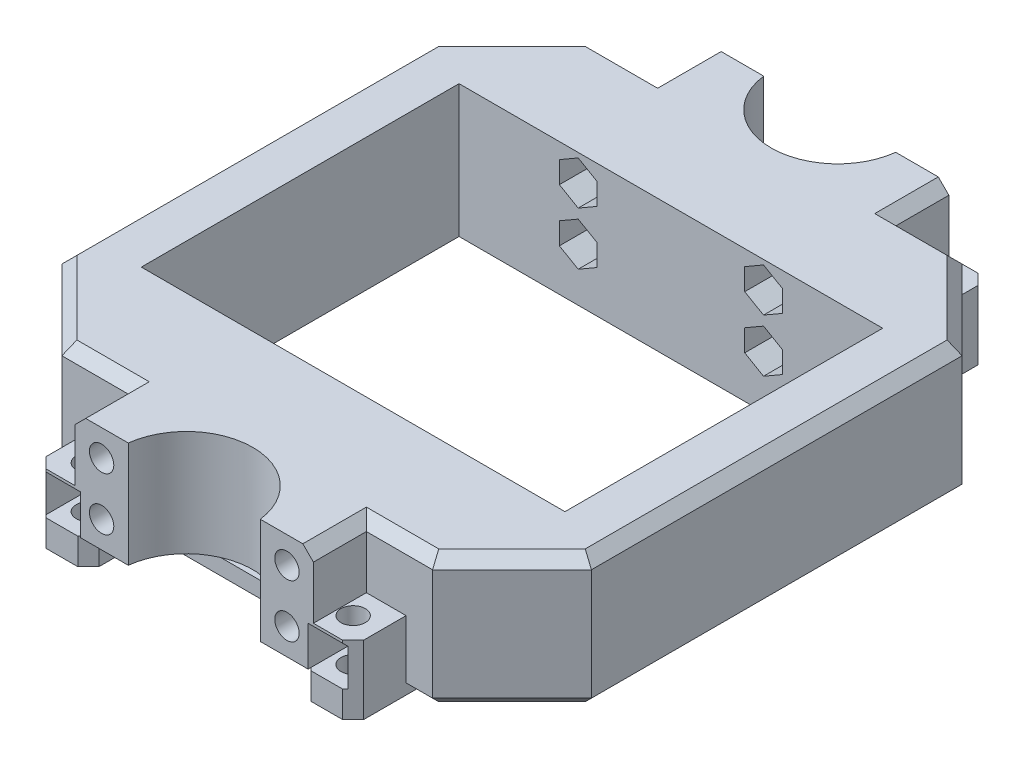
from build123d import *

# Parameters (mm, degrees)
SKETCH1_W           = 100
SKETCH1_H           = 50
BOSS_EXTRUDE1_DEPTH = 25
CHAMFER1_SIZE       = 15
CUT_EXTRUDE1_REACH  = 77
SKETCH2_W           = 80
SKETCH2_H           = 30
BOSS_EXTRUDE3_START = -25
SKETCH3_W           = 10
SKETCH3_H           = 10
SKETCH3_R           = 2.3
BOSS_EXTRUDE3_DEPTH = 13
SKETCH4_W           = 7
SKETCH4_H           = 3.5
CUT_EXTRUDE2_DEPTH  = 9
CHAMFER2_SIZE       = 4
SKETCH9_W           = 45
SKETCH9_H           = 20
BOSS_EXTRUDE4_DEPTH = 10
SKETCH4_2_W         = 7
SKETCH4_2_H         = 3.5
CUT_EXTRUDE3_DEPTH  = 10
CHAMFER3_SIZE       = 4
SKETCH10_R          = 12.55
CUT_EXTRUDE4_DEPTH  = 20
CUT_EXTRUDE5_REACH  = 84.006
SKETCH11_R          = 2.3
CUT_EXTRUDE6_REACH  = 94.006
CUT_EXTRUDE6_START  = -10
SKETCH13_W          = 40
SKETCH13_H          = 5
CUT_EXTRUDE7_DEPTH  = 5
CHAMFER5_SIZE       = 4.75


# Some blends are built 0.0001 mm under size
with BuildPart() as part:
    # Sketch1 → Boss-Extrude1 (new body)
    with BuildSketch(Plane(origin=(0, 0, 0), x_dir=(1, 0, 0), z_dir=(0, 1, 0))):
        with Locations((0, 25)):
            Rectangle(SKETCH1_W, SKETCH1_H)
    extrude(amount=BOSS_EXTRUDE1_DEPTH)

    # Chamfer1
    chamfer1_edges = [part.edges().sort_by_distance(p)[0] for p in [
        (50, 12.5, 0),
        (-50, 12.5, 0),
    ]]
    chamfer(chamfer1_edges, length=CHAMFER1_SIZE)

    # Sketch2 → Cut-Extrude1 (cut, up to next)
    with BuildSketch(Plane(origin=(0, 25, 0), x_dir=(1, 0, 0), z_dir=(0, 1, 0)), mode=Mode.PRIVATE) as cut_extrude1_sk1:
        with Locations((0, 35)):
            Rectangle(SKETCH2_W, SKETCH2_H)
    cut_extrude1_tool1 = extrude(cut_extrude1_sk1.sketch, amount=-CUT_EXTRUDE1_REACH, mode=Mode.PRIVATE) & part.part
    add(cut_extrude1_tool1.solids().sort_by_distance((0, 25, -35))[0], mode=Mode.SUBTRACT)

    # Sketch3 → Boss-Extrude3 (add)
    # profile 1 of 2: a face of its own
    with BuildSketch(Plane(origin=(0, 25, 0), x_dir=(1, 0, 0), z_dir=(0, 1, 0)).offset(BOSS_EXTRUDE3_START)):
        with Locations((25, -5)):
            Rectangle(SKETCH3_W, SKETCH3_H)
        with Locations(Location((25, -5, 0), (0, 0, 90))):
            Circle(SKETCH3_R, mode=Mode.SUBTRACT)
    # profile 2 of 2: a face of its own
    with BuildSketch(Plane(origin=(0, 25, 0), x_dir=(1, 0, 0), z_dir=(0, 1, 0)).offset(BOSS_EXTRUDE3_START)):
        with Locations((-25, -5)):
            Rectangle(SKETCH3_W, SKETCH3_H)
        with Locations(Location((-25, -5, 0), (0, 0, 90))):
            Circle(SKETCH3_R, mode=Mode.SUBTRACT)
    extrude(amount=BOSS_EXTRUDE3_DEPTH)

    # Sketch4 → Cut-Extrude2 (cut)
    with BuildSketch(Plane.XY.offset(10)):
        with Locations((25, 6.75)):
            Rectangle(SKETCH4_W, SKETCH4_H)
        with Locations((-25, 6.75)):
            Rectangle(SKETCH4_W, SKETCH4_H)
    extrude(amount=-CUT_EXTRUDE2_DEPTH, mode=Mode.SUBTRACT)

    # Chamfer2
    # the kernel refuses this chamfer: 4 mm, written as the material it takes off along each edge
    with BuildSketch(Plane(origin=(28.5, 8.5, 10), x_dir=(0, 0.9996219169112968, 0.02749587661058735), z_dir=(-1, 0, 0)), Plane(origin=(-21.5, 8.5, 10), x_dir=(0, 0.9996219169112968, 0.027495876610588214), z_dir=(-1, 0, 0))) as chamfer2_piece_1:
        Polygon((CHAMFER2_SIZE * 0.999621916911, CHAMFER2_SIZE * 0.0274958766106), (-CHAMFER2_SIZE * 0.0274958766106, CHAMFER2_SIZE * 0.999621916911), (0, 0), align=None)
    extrude(amount=7, mode=Mode.SUBTRACT)

    # Sketch9 → Boss-Extrude4 (add)
    with BuildSketch(Plane.XY.offset(10)):
        with Locations((0, 15)):
            Rectangle(SKETCH9_W, SKETCH9_H)
    extrude(amount=-BOSS_EXTRUDE4_DEPTH)

    # Sketch4<2> → Cut-Extrude3 (cut)
    with BuildSketch(Plane.XY.offset(10)):
        with Locations((25, 6.75)):
            Rectangle(SKETCH4_2_W, SKETCH4_2_H)
        with Locations((-25, 6.75)):
            Rectangle(SKETCH4_2_W, SKETCH4_2_H)
    extrude(amount=-CUT_EXTRUDE3_DEPTH, mode=Mode.SUBTRACT)

    # Chamfer3
    chamfer3_edges = [part.edges().sort_by_distance(p)[0] for p in [
        (-22, 8.5, 10),
        (22, 8.5, 10),
    ]]
    chamfer(chamfer3_edges, length=CHAMFER3_SIZE - 0.0001)  # a hair under: the kernel refuses the full size

    # Sketch10 → Cut-Extrude4 (cut)
    with BuildSketch(Plane(origin=(0, 25, 0), x_dir=(1, 0, 0), z_dir=(0, 1, 0))):
        with Locations((0, -11.5)):
            Circle(SKETCH10_R)
    extrude(amount=-CUT_EXTRUDE4_DEPTH, mode=Mode.SUBTRACT)

    # Sketch11 → Cut-Extrude5 (cut, up to next)
    with BuildSketch(Plane.XY.offset(10), mode=Mode.PRIVATE) as cut_extrude5_sk1:
        with Locations((-17.5, 20)):
            Circle(SKETCH11_R)
    cut_extrude5_tool1 = extrude(cut_extrude5_sk1.sketch, amount=-CUT_EXTRUDE5_REACH, mode=Mode.PRIVATE) & part.part
    # Sketch11 → Cut-Extrude5 (cut, up to next)
    with BuildSketch(Plane.XY.offset(10), mode=Mode.PRIVATE) as cut_extrude5_sk2:
        with Locations((-17.5, 10)):
            Circle(SKETCH11_R)
    cut_extrude5_tool2 = extrude(cut_extrude5_sk2.sketch, amount=-CUT_EXTRUDE5_REACH, mode=Mode.PRIVATE) & part.part
    cut_extrude5_1 = cut_extrude5_tool1.solids().sort_by_distance((-17.5, 20, 10))[0]
    add(cut_extrude5_1, mode=Mode.SUBTRACT)
    cut_extrude5_2 = cut_extrude5_tool2.solids().sort_by_distance((-17.5, 10, 10))[0]
    add(cut_extrude5_2, mode=Mode.SUBTRACT)
    cut_extrude5 = cut_extrude5_1 + cut_extrude5_2  # Cut-Extrude5 as one shape, for the pattern or mirror that repeats it

    # Mirror1: Cut-Extrude5 across plane
    add(cut_extrude5.mirror(Plane(origin=(0, 0, 0), x_dir=(0, 0, 1), z_dir=(1, 0, 0))), mode=Mode.SUBTRACT)

    # Sketch12 → Cut-Extrude6 (cut, up to next)
    with BuildSketch(Plane.XY.offset(10).offset(CUT_EXTRUDE6_START), mode=Mode.PRIVATE) as cut_extrude6_sk1:
        Polygon((-13.95, 22.049593456), (-17.5, 24.099186911), (-21.05, 22.049593456), (-21.05, 17.950406544), (-17.5, 15.900813089), (-13.95, 17.950406544), align=None)
    cut_extrude6_tool1 = extrude(cut_extrude6_sk1.sketch, amount=-CUT_EXTRUDE6_REACH, mode=Mode.PRIVATE) & part.part
    # Sketch12 → Cut-Extrude6 (cut, up to next)
    with BuildSketch(Plane.XY.offset(10).offset(CUT_EXTRUDE6_START), mode=Mode.PRIVATE) as cut_extrude6_sk2:
        Polygon((-13.95, 12.049593456), (-17.5, 14.099186911), (-21.05, 12.049593456), (-21.05, 7.950406544), (-17.5, 5.900813089), (-13.95, 7.950406544), align=None)
    cut_extrude6_tool2 = extrude(cut_extrude6_sk2.sketch, amount=-CUT_EXTRUDE6_REACH, mode=Mode.PRIVATE) & part.part
    cut_extrude6_1 = cut_extrude6_tool1.solids().sort_by_distance((-17.5, 20, 0))[0]
    add(cut_extrude6_1, mode=Mode.SUBTRACT)
    cut_extrude6_2 = cut_extrude6_tool2.solids().sort_by_distance((-17.5, 10, 0))[0]
    add(cut_extrude6_2, mode=Mode.SUBTRACT)
    cut_extrude6 = cut_extrude6_1 + cut_extrude6_2  # Cut-Extrude6 as one shape, for the pattern or mirror that repeats it

    # Mirror2: Cut-Extrude6 across plane
    add(cut_extrude6.mirror(Plane(origin=(0, 0, 0), x_dir=(0, 0, 1), z_dir=(1, 0, 0))), mode=Mode.SUBTRACT)

    # Chamfer4
    # the kernel refuses this chamfer: 2 mm, written as the material it takes off along each edge
    with BuildSketch(Plane(origin=(-20, 0, 0), x_dir=(0, -0.02749587661058641, -0.9996219169112968), z_dir=(1, 0, 0))) as chamfer4_piece_1:
        with BuildLine():
            Line((2.05734639, 0), (-0.11309431, 2.054235587))
            Line((-0.11309431, 2.054235587), (-0.153079186, 2.053135752))
            ThreePointArc((-0.153079186, 2.053135752), (-0.068258454, 1.026795659), (-0.039984877, -0.001099835))
            Line((-0.039984877, -0.001099835), (0.001099835, -0.039984877))
            ThreePointArc((0.001099835, -0.039984877), (1.028995329, -0.011711299), (2.058446225, -0.039984877))
            Line((2.058446225, -0.039984877), (2.05734639, 0))
        make_face()
    extrude(amount=40, mode=Mode.SUBTRACT)
    with BuildSketch(Plane(origin=(-40.143365976, 0, 0), x_dir=(0, -0.027495876610586358, -0.9996219169112968), z_dir=(1, 0, 0))) as chamfer4_piece_2_section:
        with BuildLine():
            Line((2.05734639, 0), (-0.11309431, 2.054235587))
            Line((-0.11309431, 2.054235587), (-0.153079186, 2.053135752))
            ThreePointArc((-0.153079186, 2.053135752), (-0.068258454, 1.026795659), (-0.039984877, -0.001099835))
            Line((-0.039984877, -0.001099835), (0.001099835, -0.039984877))
            ThreePointArc((0.001099835, -0.039984877), (1.028995329, -0.011711299), (2.058446225, -0.039984877))
            Line((2.058446225, -0.039984877), (2.05734639, 0))
        make_face()
    chamfer4_piece_2 = extrude(amount=10.143365976, mode=Mode.PRIVATE)
    chamfer4_piece_2 = split(chamfer4_piece_2, bisect_by=Plane(origin=(-34.278351487, 0.635593467, 0.721648513), z_dir=(0.7071067811865476, 0, -0.7071067811865476)), keep=Keep.TOP, mode=Mode.PRIVATE)
    add(chamfer4_piece_2, mode=Mode.SUBTRACT)
    with BuildSketch(Plane(origin=(-50, 0, -50), x_dir=(0.9996219169112968, -0.02749587661058639, 0), z_dir=(0, 0, 1))) as chamfer4_piece_3_section:
        with BuildLine():
            Line((2.05734639, 0), (-0.11309431, 2.054235587))
            Line((-0.11309431, 2.054235587), (-0.153079186, 2.053135752))
            ThreePointArc((-0.153079186, 2.053135752), (-0.068258454, 1.026795659), (-0.039984877, -0.001099835))
            Line((-0.039984877, -0.001099835), (0.001099835, -0.039984877))
            ThreePointArc((0.001099835, -0.039984877), (1.028995329, -0.011711299), (2.058446225, -0.039984877))
            Line((2.058446225, -0.039984877), (2.05734639, 0))
        make_face()
    chamfer4_piece_3 = extrude(amount=40.143365976, mode=Mode.PRIVATE)
    chamfer4_piece_3 = split(chamfer4_piece_3, bisect_by=Plane(origin=(-58.249967164, 0.655779163, -23.249967164), z_dir=(0.7071067811865476, 0, -0.7071067811865476)), keep=Keep.TOP, mode=Mode.PRIVATE)
    add(chamfer4_piece_3, mode=Mode.SUBTRACT)
    with BuildSketch(Plane(origin=(-50, 25, -50), x_dir=(0.9996219169112968, 0.027495876610585647, 0), z_dir=(0, 0, 1))) as chamfer4_piece_4_section:
        with BuildLine():
            Line((2.05734639, 0), (-0.11309431, -2.054235587))
            Line((-0.11309431, -2.054235587), (-0.153079186, -2.053135752))
            ThreePointArc((-0.153079186, -2.053135752), (-0.068258454, -1.026795659), (-0.039984877, 0.001099835))
            Line((-0.039984877, 0.001099835), (0.001099835, 0.039984877))
            ThreePointArc((0.001099835, 0.039984877), (1.028995329, 0.011711299), (2.058446225, 0.039984877))
            Line((2.058446225, 0.039984877), (2.05734639, 0))
        make_face()
    chamfer4_piece_4 = extrude(amount=40.143365976, mode=Mode.PRIVATE)
    chamfer4_piece_4 = split(chamfer4_piece_4, bisect_by=Plane(origin=(-58.249967164, 24.344220837, -23.249967164), z_dir=(0.7071067811865476, 0, -0.7071067811865476)), keep=Keep.TOP, mode=Mode.PRIVATE)
    add(chamfer4_piece_4, mode=Mode.SUBTRACT)
    with BuildSketch(Plane(origin=(-31.36309104, 25, 3.63690896), x_dir=(0.7068394360706735, 0.027495876610585616, -0.7068394360706735), z_dir=(-0.7071067811865476, 0, -0.7071067811865476))) as chamfer4_piece_5_section:
        with BuildLine():
            Line((2.05734639, 0), (-0.11309431, 2.054235587))
            Line((-0.11309431, 2.054235587), (-0.153079186, 2.053135752))
            ThreePointArc((-0.153079186, 2.053135752), (-0.068258454, 1.026795659), (-0.039984877, -0.001099835))
            Line((-0.039984877, -0.001099835), (0.001099835, -0.039984877))
            ThreePointArc((0.001099835, -0.039984877), (1.028995329, -0.011711299), (2.058446225, -0.039984877))
            Line((2.058446225, -0.039984877), (2.05734639, 0))
        make_face()
    chamfer4_piece_5 = extrude(amount=31.499935387, mode=Mode.PRIVATE)
    chamfer4_piece_5 = split(chamfer4_piece_5, bisect_by=Plane(origin=(-42.017658783, 24.352466062, 0), z_dir=(0, 0, -1)), keep=Keep.TOP, mode=Mode.PRIVATE)
    chamfer4_piece_5 = split(chamfer4_piece_5, bisect_by=Plane(origin=(-50, 24.352466062, -7.982341217), z_dir=(1, 0, 0)), keep=Keep.TOP, mode=Mode.PRIVATE)
    add(chamfer4_piece_5, mode=Mode.SUBTRACT)
    with BuildSketch(Plane(origin=(-31.36309104, 0, 3.63690896), x_dir=(0.7068394360706735, -0.027495876610586365, -0.7068394360706735), z_dir=(-0.7071067811865476, 0, -0.7071067811865476))) as chamfer4_piece_6_section:
        with BuildLine():
            Line((2.05734639, 0), (-0.11309431, -2.054235587))
            Line((-0.11309431, -2.054235587), (-0.153079186, -2.053135752))
            ThreePointArc((-0.153079186, -2.053135752), (-0.068258454, -1.026795659), (-0.039984877, 0.001099835))
            Line((-0.039984877, 0.001099835), (0.001099835, 0.039984877))
            ThreePointArc((0.001099835, 0.039984877), (1.028995329, 0.011711299), (2.058446225, 0.039984877))
            Line((2.058446225, 0.039984877), (2.05734639, 0))
        make_face()
    chamfer4_piece_6 = extrude(amount=31.499935387, mode=Mode.PRIVATE)
    chamfer4_piece_6 = split(chamfer4_piece_6, bisect_by=Plane(origin=(-42.017658783, 0.647533938, 0), z_dir=(0, 0, -1)), keep=Keep.TOP, mode=Mode.PRIVATE)
    chamfer4_piece_6 = split(chamfer4_piece_6, bisect_by=Plane(origin=(-50, 0.647533938, -7.982341217), z_dir=(1, 0, 0)), keep=Keep.TOP, mode=Mode.PRIVATE)
    add(chamfer4_piece_6, mode=Mode.SUBTRACT)
    with BuildSketch(Plane(origin=(-40.143365976, 25, 0), x_dir=(0, 0.027495876610585623, -0.9996219169112968), z_dir=(1, 0, 0))) as chamfer4_piece_7_section:
        with BuildLine():
            Line((2.05734639, 0), (-0.11309431, -2.054235587))
            Line((-0.11309431, -2.054235587), (-0.153079186, -2.053135752))
            ThreePointArc((-0.153079186, -2.053135752), (-0.068258454, -1.026795659), (-0.039984877, 0.001099835))
            Line((-0.039984877, 0.001099835), (0.001099835, 0.039984877))
            ThreePointArc((0.001099835, 0.039984877), (1.028995329, 0.011711299), (2.058446225, 0.039984877))
            Line((2.058446225, 0.039984877), (2.05734639, 0))
        make_face()
    chamfer4_piece_7 = extrude(amount=17.643365976, mode=Mode.PRIVATE)
    chamfer4_piece_7 = split(chamfer4_piece_7, bisect_by=Plane(origin=(-32.384167158, 24.350731834, 2.615832842), z_dir=(0.7071067811865476, 0, -0.7071067811865476)), keep=Keep.TOP, mode=Mode.PRIVATE)
    add(chamfer4_piece_7, mode=Mode.SUBTRACT)
    with BuildSketch(Plane(origin=(-22.5, 25, 10), x_dir=(-0.027495876610585647, -0.9996219169112968, 0), z_dir=(0, 0, -1)), Plane(origin=(22.5, 25, 10), x_dir=(-0.9996219169112968, 0.027495876610585647, 0), z_dir=(0, 0, -1))) as chamfer4_piece_8:
        with BuildLine():
            Line((2.05734639, 0), (-0.11309431, -2.054235587))
            Line((-0.11309431, -2.054235587), (-0.153079186, -2.053135752))
            ThreePointArc((-0.153079186, -2.053135752), (-0.068258454, -1.026795659), (-0.039984877, 0.001099835))
            Line((-0.039984877, 0.001099835), (0.001099835, 0.039984877))
            ThreePointArc((0.001099835, 0.039984877), (1.028995329, 0.011711299), (2.058446225, 0.039984877))
            Line((2.058446225, 0.039984877), (2.05734639, 0))
        make_face()
    extrude(amount=10, mode=Mode.SUBTRACT)
    with BuildSketch(Plane(origin=(-30, 0, 10), x_dir=(0.9996219169112968, 0, 0.02749587661058651), z_dir=(0, 1, 0))) as chamfer4_piece_9:
        with BuildLine():
            Line((2.05734639, 0), (-0.11309431, 2.054235587))
            Line((-0.11309431, 2.054235587), (-0.153079186, 2.053135752))
            ThreePointArc((-0.153079186, 2.053135752), (-0.068258454, 1.026795659), (-0.039984877, -0.001099835))
            Line((-0.039984877, -0.001099835), (0.001099835, -0.039984877))
            ThreePointArc((0.001099835, -0.039984877), (1.028995329, -0.011711299), (2.058446225, -0.039984877))
            Line((2.058446225, -0.039984877), (2.05734639, 0))
        make_face()
    extrude(amount=13, mode=Mode.SUBTRACT)
    with BuildSketch(Plane(origin=(-20, 0, 10), x_dir=(-0.9996219169112968, 0, 0.02749587661058651), z_dir=(0, 1, 0)), Plane(origin=(20, 0, 10), x_dir=(-0.027495876610585623, 0, -0.9996219169112968), z_dir=(0, 1, 0))) as chamfer4_piece_10:
        with BuildLine():
            Line((2.05734639, 0), (-0.11309431, -2.054235587))
            Line((-0.11309431, -2.054235587), (-0.153079186, -2.053135752))
            ThreePointArc((-0.153079186, -2.053135752), (-0.068258454, -1.026795659), (-0.039984877, 0.001099835))
            Line((-0.039984877, 0.001099835), (0.001099835, 0.039984877))
            ThreePointArc((0.001099835, 0.039984877), (1.028995329, 0.011711299), (2.058446225, 0.039984877))
            Line((2.058446225, 0.039984877), (2.05734639, 0))
        make_face()
    extrude(amount=5, mode=Mode.SUBTRACT)
    with BuildSketch(Plane(origin=(30, 0, 10), x_dir=(-0.999621916911297, 0, 0.02749587661057961), z_dir=(0, 1, 0))) as chamfer4_piece_11:
        with BuildLine():
            Line((2.05734639, 0), (-0.11309431, -2.054235587))
            Line((-0.11309431, -2.054235587), (-0.153079186, -2.053135752))
            ThreePointArc((-0.153079186, -2.053135752), (-0.068258454, -1.026795659), (-0.039984877, 0.001099835))
            Line((-0.039984877, 0.001099835), (0.001099835, 0.039984877))
            ThreePointArc((0.001099835, 0.039984877), (1.028995329, 0.011711299), (2.058446225, 0.039984877))
            Line((2.058446225, 0.039984877), (2.05734639, 0))
        make_face()
    extrude(amount=13, mode=Mode.SUBTRACT)
    with BuildSketch(Plane(origin=(30, 0, 0), x_dir=(0, -0.027495876610586382, -0.9996219169112968), z_dir=(1, 0, 0))) as chamfer4_piece_12_section:
        with BuildLine():
            Line((2.05734639, 0), (-0.11309431, 2.054235587))
            Line((-0.11309431, 2.054235587), (-0.153079186, 2.053135752))
            ThreePointArc((-0.153079186, 2.053135752), (-0.068258454, 1.026795659), (-0.039984877, -0.001099835))
            Line((-0.039984877, -0.001099835), (0.001099835, -0.039984877))
            ThreePointArc((0.001099835, -0.039984877), (1.028995329, -0.011711299), (2.058446225, -0.039984877))
            Line((2.058446225, -0.039984877), (2.05734639, 0))
        make_face()
    chamfer4_piece_12 = extrude(amount=10.143365976, mode=Mode.PRIVATE)
    chamfer4_piece_12 = split(chamfer4_piece_12, bisect_by=Plane(origin=(34.278351487, 0.635593467, 0.721648513), z_dir=(-0.7071067811865476, 0, -0.7071067811865475)), keep=Keep.TOP, mode=Mode.PRIVATE)
    add(chamfer4_piece_12, mode=Mode.SUBTRACT)
    with BuildSketch(Plane(origin=(31.36309104, 25, 3.63690896), x_dir=(-0.7068394360706735, 0.027495876610585616, -0.7068394360706735), z_dir=(0.7071067811865475, 0, -0.7071067811865476))) as chamfer4_piece_13_section:
        with BuildLine():
            Line((2.05734639, 0), (-0.11309431, -2.054235587))
            Line((-0.11309431, -2.054235587), (-0.153079186, -2.053135752))
            ThreePointArc((-0.153079186, -2.053135752), (-0.068258454, -1.026795659), (-0.039984877, 0.001099835))
            Line((-0.039984877, 0.001099835), (0.001099835, 0.039984877))
            ThreePointArc((0.001099835, 0.039984877), (1.028995329, 0.011711299), (2.058446225, 0.039984877))
            Line((2.058446225, 0.039984877), (2.05734639, 0))
        make_face()
    chamfer4_piece_13 = extrude(amount=31.499935387, mode=Mode.PRIVATE)
    chamfer4_piece_13 = split(chamfer4_piece_13, bisect_by=Plane(origin=(42.017658783, 24.352466062, 0), z_dir=(0, 0, -1)), keep=Keep.TOP, mode=Mode.PRIVATE)
    chamfer4_piece_13 = split(chamfer4_piece_13, bisect_by=Plane(origin=(50, 24.352466062, -7.982341217), z_dir=(-1, 0, 0)), keep=Keep.TOP, mode=Mode.PRIVATE)
    add(chamfer4_piece_13, mode=Mode.SUBTRACT)
    with BuildSketch(Plane(origin=(31.36309104, 0, 3.63690896), x_dir=(-0.7068394360706735, -0.02749587661058635, -0.7068394360706735), z_dir=(0.7071067811865475, 0, -0.7071067811865476))) as chamfer4_piece_14_section:
        with BuildLine():
            Line((2.05734639, 0), (-0.11309431, 2.054235587))
            Line((-0.11309431, 2.054235587), (-0.153079186, 2.053135752))
            ThreePointArc((-0.153079186, 2.053135752), (-0.068258454, 1.026795659), (-0.039984877, -0.001099835))
            Line((-0.039984877, -0.001099835), (0.001099835, -0.039984877))
            ThreePointArc((0.001099835, -0.039984877), (1.028995329, -0.011711299), (2.058446225, -0.039984877))
            Line((2.058446225, -0.039984877), (2.05734639, 0))
        make_face()
    chamfer4_piece_14 = extrude(amount=31.499935387, mode=Mode.PRIVATE)
    chamfer4_piece_14 = split(chamfer4_piece_14, bisect_by=Plane(origin=(42.017658783, 0.647533938, 0), z_dir=(0, 0, -1)), keep=Keep.TOP, mode=Mode.PRIVATE)
    chamfer4_piece_14 = split(chamfer4_piece_14, bisect_by=Plane(origin=(50, 0.647533938, -7.982341217), z_dir=(-1, 0, 0)), keep=Keep.TOP, mode=Mode.PRIVATE)
    add(chamfer4_piece_14, mode=Mode.SUBTRACT)
    with BuildSketch(Plane(origin=(50, 25, -9.856634024), x_dir=(-0.9996219169112968, 0.027495876610585647, 0), z_dir=(0, 0, -1))) as chamfer4_piece_15_section:
        with BuildLine():
            Line((2.05734639, 0), (-0.11309431, -2.054235587))
            Line((-0.11309431, -2.054235587), (-0.153079186, -2.053135752))
            ThreePointArc((-0.153079186, -2.053135752), (-0.068258454, -1.026795659), (-0.039984877, 0.001099835))
            Line((-0.039984877, 0.001099835), (0.001099835, 0.039984877))
            ThreePointArc((0.001099835, 0.039984877), (1.028995329, 0.011711299), (2.058446225, 0.039984877))
            Line((2.058446225, 0.039984877), (2.05734639, 0))
        make_face()
    chamfer4_piece_15 = extrude(amount=40.143365976, mode=Mode.PRIVATE)
    chamfer4_piece_15 = split(chamfer4_piece_15, bisect_by=Plane(origin=(58.249967164, 24.344220837, -23.249967164), z_dir=(-0.7071067811865476, 0, -0.7071067811865475)), keep=Keep.TOP, mode=Mode.PRIVATE)
    add(chamfer4_piece_15, mode=Mode.SUBTRACT)
    with BuildSketch(Plane(origin=(50, 0, -9.856634024), x_dir=(-0.9996219169112968, -0.02749587661058639, 0), z_dir=(0, 0, -1))) as chamfer4_piece_16_section:
        with BuildLine():
            Line((2.05734639, 0), (-0.11309431, 2.054235587))
            Line((-0.11309431, 2.054235587), (-0.153079186, 2.053135752))
            ThreePointArc((-0.153079186, 2.053135752), (-0.068258454, 1.026795659), (-0.039984877, -0.001099835))
            Line((-0.039984877, -0.001099835), (0.001099835, -0.039984877))
            ThreePointArc((0.001099835, -0.039984877), (1.028995329, -0.011711299), (2.058446225, -0.039984877))
            Line((2.058446225, -0.039984877), (2.05734639, 0))
        make_face()
    chamfer4_piece_16 = extrude(amount=40.143365976, mode=Mode.PRIVATE)
    chamfer4_piece_16 = split(chamfer4_piece_16, bisect_by=Plane(origin=(58.249967164, 0.655779163, -23.249967164), z_dir=(-0.7071067811865476, 0, -0.7071067811865475)), keep=Keep.TOP, mode=Mode.PRIVATE)
    add(chamfer4_piece_16, mode=Mode.SUBTRACT)
    with BuildSketch(Plane(origin=(22.5, 25, 0), x_dir=(0, 0.027495876610585616, -0.9996219169112968), z_dir=(1, 0, 0))) as chamfer4_piece_17_section:
        with BuildLine():
            Line((2.05734639, 0), (-0.11309431, -2.054235587))
            Line((-0.11309431, -2.054235587), (-0.153079186, -2.053135752))
            ThreePointArc((-0.153079186, -2.053135752), (-0.068258454, -1.026795659), (-0.039984877, 0.001099835))
            Line((-0.039984877, 0.001099835), (0.001099835, 0.039984877))
            ThreePointArc((0.001099835, 0.039984877), (1.028995329, 0.011711299), (2.058446225, 0.039984877))
            Line((2.058446225, 0.039984877), (2.05734639, 0))
        make_face()
    chamfer4_piece_17 = extrude(amount=17.643365976, mode=Mode.PRIVATE)
    chamfer4_piece_17 = split(chamfer4_piece_17, bisect_by=Plane(origin=(32.384167158, 24.350731834, 2.615832842), z_dir=(-0.7071067811865476, 0, -0.7071067811865475)), keep=Keep.TOP, mode=Mode.PRIVATE)
    add(chamfer4_piece_17, mode=Mode.SUBTRACT)
    with BuildSketch(Plane(origin=(-31.36309104, 0, 3.63690896), x_dir=(0.7068394360706735, -0.027495876610586365, -0.7068394360706735), z_dir=(-0.7071067811865476, 0, -0.7071067811865476))) as chamfer4_piece_18a_section:
        with BuildLine():
            Line((2.05734639, 0), (-0.11309431, -2.054235587))
            Line((-0.11309431, -2.054235587), (-0.153079186, -2.053135752))
            ThreePointArc((-0.153079186, -2.053135752), (-0.068258454, -1.026795659), (-0.039984877, 0.001099835))
            Line((-0.039984877, 0.001099835), (0.001099835, 0.039984877))
            ThreePointArc((0.001099835, 0.039984877), (1.028995329, 0.011711299), (2.058446225, 0.039984877))
            Line((2.058446225, 0.039984877), (2.05734639, 0))
        make_face()
    chamfer4_piece_18a = extrude(amount=31.499935387, mode=Mode.PRIVATE)
    chamfer4_piece_18a = split(chamfer4_piece_18a, bisect_by=Plane(origin=(-32.542034961, 0.689873077, 0), z_dir=(0, 0, 1)), keep=Keep.TOP, mode=Mode.PRIVATE)
    with BuildSketch(Plane(origin=(-40.143365976, 0, 0), x_dir=(0, -0.027495876610586358, -0.9996219169112968), z_dir=(1, 0, 0))) as chamfer4_piece_18b_section:
        with BuildLine():
            Line((2.05734639, 0), (-0.11309431, 2.054235587))
            Line((-0.11309431, 2.054235587), (-0.153079186, 2.053135752))
            ThreePointArc((-0.153079186, 2.053135752), (-0.068258454, 1.026795659), (-0.039984877, -0.001099835))
            Line((-0.039984877, -0.001099835), (0.001099835, -0.039984877))
            ThreePointArc((0.001099835, -0.039984877), (1.028995329, -0.011711299), (2.058446225, -0.039984877))
            Line((2.058446225, -0.039984877), (2.05734639, 0))
        make_face()
    chamfer4_piece_18b = extrude(amount=10.143365976, mode=Mode.PRIVATE)
    chamfer4_piece_18b = split(chamfer4_piece_18b, bisect_by=Plane(origin=(-36.738043747, 0.689873077, -1.738043747), z_dir=(-0.7071067811865476, 0, 0.7071067811865476)), keep=Keep.TOP, mode=Mode.PRIVATE)
    chamfer4_piece_18 = chamfer4_piece_18a & chamfer4_piece_18b
    add(chamfer4_piece_18, mode=Mode.SUBTRACT)
    with BuildSketch(Plane(origin=(-31.36309104, 0, 3.63690896), x_dir=(0.7068394360706735, -0.027495876610586365, -0.7068394360706735), z_dir=(-0.7071067811865476, 0, -0.7071067811865476))) as chamfer4_piece_19a_section:
        with BuildLine():
            Line((2.05734639, 0), (-0.11309431, -2.054235587))
            Line((-0.11309431, -2.054235587), (-0.153079186, -2.053135752))
            ThreePointArc((-0.153079186, -2.053135752), (-0.068258454, -1.026795659), (-0.039984877, 0.001099835))
            Line((-0.039984877, 0.001099835), (0.001099835, 0.039984877))
            ThreePointArc((0.001099835, 0.039984877), (1.028995329, 0.011711299), (2.058446225, 0.039984877))
            Line((2.058446225, 0.039984877), (2.05734639, 0))
        make_face()
    chamfer4_piece_19a = extrude(amount=31.499935387, mode=Mode.PRIVATE)
    chamfer4_piece_19a = split(chamfer4_piece_19a, bisect_by=Plane(origin=(-50, 0.689873077, -17.457965039), z_dir=(-1, 0, 0)), keep=Keep.TOP, mode=Mode.PRIVATE)
    with BuildSketch(Plane(origin=(-50, 0, -50), x_dir=(0.9996219169112968, -0.02749587661058639, 0), z_dir=(0, 0, 1))) as chamfer4_piece_19b_section:
        with BuildLine():
            Line((2.05734639, 0), (-0.11309431, 2.054235587))
            Line((-0.11309431, 2.054235587), (-0.153079186, 2.053135752))
            ThreePointArc((-0.153079186, 2.053135752), (-0.068258454, 1.026795659), (-0.039984877, -0.001099835))
            Line((-0.039984877, -0.001099835), (0.001099835, -0.039984877))
            ThreePointArc((0.001099835, -0.039984877), (1.028995329, -0.011711299), (2.058446225, -0.039984877))
            Line((2.058446225, -0.039984877), (2.05734639, 0))
        make_face()
    chamfer4_piece_19b = extrude(amount=40.143365976, mode=Mode.PRIVATE)
    chamfer4_piece_19b = split(chamfer4_piece_19b, bisect_by=Plane(origin=(-48.261956253, 0.689873077, -13.261956253), z_dir=(-0.7071067811865476, 0, 0.7071067811865476)), keep=Keep.TOP, mode=Mode.PRIVATE)
    chamfer4_piece_19 = chamfer4_piece_19a & chamfer4_piece_19b
    add(chamfer4_piece_19, mode=Mode.SUBTRACT)
    with BuildSketch(Plane(origin=(-31.36309104, 25, 3.63690896), x_dir=(0.7068394360706735, 0.027495876610585616, -0.7068394360706735), z_dir=(-0.7071067811865476, 0, -0.7071067811865476))) as chamfer4_piece_20a_section:
        with BuildLine():
            Line((2.05734639, 0), (-0.11309431, 2.054235587))
            Line((-0.11309431, 2.054235587), (-0.153079186, 2.053135752))
            ThreePointArc((-0.153079186, 2.053135752), (-0.068258454, 1.026795659), (-0.039984877, -0.001099835))
            Line((-0.039984877, -0.001099835), (0.001099835, -0.039984877))
            ThreePointArc((0.001099835, -0.039984877), (1.028995329, -0.011711299), (2.058446225, -0.039984877))
            Line((2.058446225, -0.039984877), (2.05734639, 0))
        make_face()
    chamfer4_piece_20a = extrude(amount=31.499935387, mode=Mode.PRIVATE)
    chamfer4_piece_20a = split(chamfer4_piece_20a, bisect_by=Plane(origin=(-50, 24.310126923, -17.457965039), z_dir=(-1, 0, 0)), keep=Keep.TOP, mode=Mode.PRIVATE)
    with BuildSketch(Plane(origin=(-50, 25, -50), x_dir=(0.9996219169112968, 0.027495876610585647, 0), z_dir=(0, 0, 1))) as chamfer4_piece_20b_section:
        with BuildLine():
            Line((2.05734639, 0), (-0.11309431, -2.054235587))
            Line((-0.11309431, -2.054235587), (-0.153079186, -2.053135752))
            ThreePointArc((-0.153079186, -2.053135752), (-0.068258454, -1.026795659), (-0.039984877, 0.001099835))
            Line((-0.039984877, 0.001099835), (0.001099835, 0.039984877))
            ThreePointArc((0.001099835, 0.039984877), (1.028995329, 0.011711299), (2.058446225, 0.039984877))
            Line((2.058446225, 0.039984877), (2.05734639, 0))
        make_face()
    chamfer4_piece_20b = extrude(amount=40.143365976, mode=Mode.PRIVATE)
    chamfer4_piece_20b = split(chamfer4_piece_20b, bisect_by=Plane(origin=(-48.261956253, 24.310126923, -13.261956253), z_dir=(-0.7071067811865476, 0, 0.7071067811865476)), keep=Keep.TOP, mode=Mode.PRIVATE)
    chamfer4_piece_20 = chamfer4_piece_20a & chamfer4_piece_20b
    add(chamfer4_piece_20, mode=Mode.SUBTRACT)
    with BuildSketch(Plane(origin=(-31.36309104, 25, 3.63690896), x_dir=(0.7068394360706735, 0.027495876610585616, -0.7068394360706735), z_dir=(-0.7071067811865476, 0, -0.7071067811865476))) as chamfer4_piece_21a_section:
        with BuildLine():
            Line((2.05734639, 0), (-0.11309431, 2.054235587))
            Line((-0.11309431, 2.054235587), (-0.153079186, 2.053135752))
            ThreePointArc((-0.153079186, 2.053135752), (-0.068258454, 1.026795659), (-0.039984877, -0.001099835))
            Line((-0.039984877, -0.001099835), (0.001099835, -0.039984877))
            ThreePointArc((0.001099835, -0.039984877), (1.028995329, -0.011711299), (2.058446225, -0.039984877))
            Line((2.058446225, -0.039984877), (2.05734639, 0))
        make_face()
    chamfer4_piece_21a = extrude(amount=31.499935387, mode=Mode.PRIVATE)
    chamfer4_piece_21a = split(chamfer4_piece_21a, bisect_by=Plane(origin=(-32.542034961, 24.310126923, 0), z_dir=(0, 0, 1)), keep=Keep.TOP, mode=Mode.PRIVATE)
    with BuildSketch(Plane(origin=(-40.143365976, 25, 0), x_dir=(0, 0.027495876610585623, -0.9996219169112968), z_dir=(1, 0, 0))) as chamfer4_piece_21b_section:
        with BuildLine():
            Line((2.05734639, 0), (-0.11309431, -2.054235587))
            Line((-0.11309431, -2.054235587), (-0.153079186, -2.053135752))
            ThreePointArc((-0.153079186, -2.053135752), (-0.068258454, -1.026795659), (-0.039984877, 0.001099835))
            Line((-0.039984877, 0.001099835), (0.001099835, 0.039984877))
            ThreePointArc((0.001099835, 0.039984877), (1.028995329, 0.011711299), (2.058446225, 0.039984877))
            Line((2.058446225, 0.039984877), (2.05734639, 0))
        make_face()
    chamfer4_piece_21b = extrude(amount=17.643365976, mode=Mode.PRIVATE)
    chamfer4_piece_21b = split(chamfer4_piece_21b, bisect_by=Plane(origin=(-36.738043747, 24.310126923, -1.738043747), z_dir=(-0.7071067811865476, 0, 0.7071067811865476)), keep=Keep.TOP, mode=Mode.PRIVATE)
    chamfer4_piece_21 = chamfer4_piece_21a & chamfer4_piece_21b
    add(chamfer4_piece_21, mode=Mode.SUBTRACT)
    with BuildSketch(Plane(origin=(-22.5, 25, 10), x_dir=(-0.027495876610585647, -0.9996219169112968, 0), z_dir=(0, 0, -1))) as chamfer4_piece_22a_section:
        with BuildLine():
            Line((2.05734639, 0), (-0.11309431, -2.054235587))
            Line((-0.11309431, -2.054235587), (-0.153079186, -2.053135752))
            ThreePointArc((-0.153079186, -2.053135752), (-0.068258454, -1.026795659), (-0.039984877, 0.001099835))
            Line((-0.039984877, 0.001099835), (0.001099835, 0.039984877))
            ThreePointArc((0.001099835, 0.039984877), (1.028995329, 0.011711299), (2.058446225, 0.039984877))
            Line((2.058446225, 0.039984877), (2.05734639, 0))
        make_face()
    chamfer4_piece_22a = extrude(amount=15.143365976, mode=Mode.PRIVATE)
    chamfer4_piece_22a = split(chamfer4_piece_22a, bisect_by=Plane(origin=(-21.840412746, 24.340412746, 0), z_dir=(0, 0, -1)), keep=Keep.TOP, mode=Mode.PRIVATE)
    with BuildSketch(Plane(origin=(-40.143365976, 25, 0), x_dir=(0, 0.027495876610585623, -0.9996219169112968), z_dir=(1, 0, 0))) as chamfer4_piece_22b_section:
        with BuildLine():
            Line((2.05734639, 0), (-0.11309431, -2.054235587))
            Line((-0.11309431, -2.054235587), (-0.153079186, -2.053135752))
            ThreePointArc((-0.153079186, -2.053135752), (-0.068258454, -1.026795659), (-0.039984877, 0.001099835))
            Line((-0.039984877, 0.001099835), (0.001099835, 0.039984877))
            ThreePointArc((0.001099835, 0.039984877), (1.028995329, 0.011711299), (2.058446225, 0.039984877))
            Line((2.058446225, 0.039984877), (2.05734639, 0))
        make_face()
    chamfer4_piece_22b = extrude(amount=22.786731952, mode=Mode.PRIVATE)
    chamfer4_piece_22b = split(chamfer4_piece_22b, bisect_by=Plane(origin=(-22.5, 24.340412746, -0.659587254), z_dir=(1, 0, 0)), keep=Keep.TOP, mode=Mode.PRIVATE)
    chamfer4_piece_22 = chamfer4_piece_22a & chamfer4_piece_22b
    add(chamfer4_piece_22, mode=Mode.SUBTRACT)
    with BuildSketch(Plane(origin=(30, 0, 0), x_dir=(0, -0.027495876610586382, -0.9996219169112968), z_dir=(1, 0, 0))) as chamfer4_piece_23a_section:
        with BuildLine():
            Line((2.05734639, 0), (-0.11309431, 2.054235587))
            Line((-0.11309431, 2.054235587), (-0.153079186, 2.053135752))
            ThreePointArc((-0.153079186, 2.053135752), (-0.068258454, 1.026795659), (-0.039984877, -0.001099835))
            Line((-0.039984877, -0.001099835), (0.001099835, -0.039984877))
            ThreePointArc((0.001099835, -0.039984877), (1.028995329, -0.011711299), (2.058446225, -0.039984877))
            Line((2.058446225, -0.039984877), (2.05734639, 0))
        make_face()
    chamfer4_piece_23a = extrude(amount=10.143365976, mode=Mode.PRIVATE)
    chamfer4_piece_23a = split(chamfer4_piece_23a, bisect_by=Plane(origin=(36.738043747, 0.689873077, -1.738043747), z_dir=(0.7071067811865476, 0, 0.7071067811865475)), keep=Keep.TOP, mode=Mode.PRIVATE)
    with BuildSketch(Plane(origin=(31.36309104, 0, 3.63690896), x_dir=(-0.7068394360706735, -0.02749587661058635, -0.7068394360706735), z_dir=(0.7071067811865475, 0, -0.7071067811865476))) as chamfer4_piece_23b_section:
        with BuildLine():
            Line((2.05734639, 0), (-0.11309431, 2.054235587))
            Line((-0.11309431, 2.054235587), (-0.153079186, 2.053135752))
            ThreePointArc((-0.153079186, 2.053135752), (-0.068258454, 1.026795659), (-0.039984877, -0.001099835))
            Line((-0.039984877, -0.001099835), (0.001099835, -0.039984877))
            ThreePointArc((0.001099835, -0.039984877), (1.028995329, -0.011711299), (2.058446225, -0.039984877))
            Line((2.058446225, -0.039984877), (2.05734639, 0))
        make_face()
    chamfer4_piece_23b = extrude(amount=31.499935387, mode=Mode.PRIVATE)
    chamfer4_piece_23b = split(chamfer4_piece_23b, bisect_by=Plane(origin=(32.542034961, 0.689873077, 0), z_dir=(0, 0, 1)), keep=Keep.TOP, mode=Mode.PRIVATE)
    chamfer4_piece_23 = chamfer4_piece_23a & chamfer4_piece_23b
    add(chamfer4_piece_23, mode=Mode.SUBTRACT)
    with BuildSketch(Plane(origin=(31.36309104, 25, 3.63690896), x_dir=(-0.7068394360706735, 0.027495876610585616, -0.7068394360706735), z_dir=(0.7071067811865475, 0, -0.7071067811865476))) as chamfer4_piece_24a_section:
        with BuildLine():
            Line((2.05734639, 0), (-0.11309431, -2.054235587))
            Line((-0.11309431, -2.054235587), (-0.153079186, -2.053135752))
            ThreePointArc((-0.153079186, -2.053135752), (-0.068258454, -1.026795659), (-0.039984877, 0.001099835))
            Line((-0.039984877, 0.001099835), (0.001099835, 0.039984877))
            ThreePointArc((0.001099835, 0.039984877), (1.028995329, 0.011711299), (2.058446225, 0.039984877))
            Line((2.058446225, 0.039984877), (2.05734639, 0))
        make_face()
    chamfer4_piece_24a = extrude(amount=31.499935387, mode=Mode.PRIVATE)
    chamfer4_piece_24a = split(chamfer4_piece_24a, bisect_by=Plane(origin=(32.542034961, 24.310126923, 0), z_dir=(0, 0, 1)), keep=Keep.TOP, mode=Mode.PRIVATE)
    with BuildSketch(Plane(origin=(22.5, 25, 0), x_dir=(0, 0.027495876610585616, -0.9996219169112968), z_dir=(1, 0, 0))) as chamfer4_piece_24b_section:
        with BuildLine():
            Line((2.05734639, 0), (-0.11309431, -2.054235587))
            Line((-0.11309431, -2.054235587), (-0.153079186, -2.053135752))
            ThreePointArc((-0.153079186, -2.053135752), (-0.068258454, -1.026795659), (-0.039984877, 0.001099835))
            Line((-0.039984877, 0.001099835), (0.001099835, 0.039984877))
            ThreePointArc((0.001099835, 0.039984877), (1.028995329, 0.011711299), (2.058446225, 0.039984877))
            Line((2.058446225, 0.039984877), (2.05734639, 0))
        make_face()
    chamfer4_piece_24b = extrude(amount=17.643365976, mode=Mode.PRIVATE)
    chamfer4_piece_24b = split(chamfer4_piece_24b, bisect_by=Plane(origin=(36.738043747, 24.310126923, -1.738043747), z_dir=(0.7071067811865476, 0, 0.7071067811865475)), keep=Keep.TOP, mode=Mode.PRIVATE)
    chamfer4_piece_24 = chamfer4_piece_24a & chamfer4_piece_24b
    add(chamfer4_piece_24, mode=Mode.SUBTRACT)
    with BuildSketch(Plane(origin=(50, 25, -9.856634024), x_dir=(-0.9996219169112968, 0.027495876610585647, 0), z_dir=(0, 0, -1))) as chamfer4_piece_25a_section:
        with BuildLine():
            Line((2.05734639, 0), (-0.11309431, -2.054235587))
            Line((-0.11309431, -2.054235587), (-0.153079186, -2.053135752))
            ThreePointArc((-0.153079186, -2.053135752), (-0.068258454, -1.026795659), (-0.039984877, 0.001099835))
            Line((-0.039984877, 0.001099835), (0.001099835, 0.039984877))
            ThreePointArc((0.001099835, 0.039984877), (1.028995329, 0.011711299), (2.058446225, 0.039984877))
            Line((2.058446225, 0.039984877), (2.05734639, 0))
        make_face()
    chamfer4_piece_25a = extrude(amount=40.143365976, mode=Mode.PRIVATE)
    chamfer4_piece_25a = split(chamfer4_piece_25a, bisect_by=Plane(origin=(48.261956253, 24.310126923, -13.261956253), z_dir=(0.7071067811865476, 0, 0.7071067811865475)), keep=Keep.TOP, mode=Mode.PRIVATE)
    with BuildSketch(Plane(origin=(31.36309104, 25, 3.63690896), x_dir=(-0.7068394360706735, 0.027495876610585616, -0.7068394360706735), z_dir=(0.7071067811865475, 0, -0.7071067811865476))) as chamfer4_piece_25b_section:
        with BuildLine():
            Line((2.05734639, 0), (-0.11309431, -2.054235587))
            Line((-0.11309431, -2.054235587), (-0.153079186, -2.053135752))
            ThreePointArc((-0.153079186, -2.053135752), (-0.068258454, -1.026795659), (-0.039984877, 0.001099835))
            Line((-0.039984877, 0.001099835), (0.001099835, 0.039984877))
            ThreePointArc((0.001099835, 0.039984877), (1.028995329, 0.011711299), (2.058446225, 0.039984877))
            Line((2.058446225, 0.039984877), (2.05734639, 0))
        make_face()
    chamfer4_piece_25b = extrude(amount=31.499935387, mode=Mode.PRIVATE)
    chamfer4_piece_25b = split(chamfer4_piece_25b, bisect_by=Plane(origin=(50, 24.310126923, -17.457965039), z_dir=(1, 0, 0)), keep=Keep.TOP, mode=Mode.PRIVATE)
    chamfer4_piece_25 = chamfer4_piece_25a & chamfer4_piece_25b
    add(chamfer4_piece_25, mode=Mode.SUBTRACT)
    with BuildSketch(Plane(origin=(31.36309104, 0, 3.63690896), x_dir=(-0.7068394360706735, -0.02749587661058635, -0.7068394360706735), z_dir=(0.7071067811865475, 0, -0.7071067811865476))) as chamfer4_piece_26a_section:
        with BuildLine():
            Line((2.05734639, 0), (-0.11309431, 2.054235587))
            Line((-0.11309431, 2.054235587), (-0.153079186, 2.053135752))
            ThreePointArc((-0.153079186, 2.053135752), (-0.068258454, 1.026795659), (-0.039984877, -0.001099835))
            Line((-0.039984877, -0.001099835), (0.001099835, -0.039984877))
            ThreePointArc((0.001099835, -0.039984877), (1.028995329, -0.011711299), (2.058446225, -0.039984877))
            Line((2.058446225, -0.039984877), (2.05734639, 0))
        make_face()
    chamfer4_piece_26a = extrude(amount=31.499935387, mode=Mode.PRIVATE)
    chamfer4_piece_26a = split(chamfer4_piece_26a, bisect_by=Plane(origin=(50, 0.689873077, -17.457965039), z_dir=(1, 0, 0)), keep=Keep.TOP, mode=Mode.PRIVATE)
    with BuildSketch(Plane(origin=(50, 0, -9.856634024), x_dir=(-0.9996219169112968, -0.02749587661058639, 0), z_dir=(0, 0, -1))) as chamfer4_piece_26b_section:
        with BuildLine():
            Line((2.05734639, 0), (-0.11309431, 2.054235587))
            Line((-0.11309431, 2.054235587), (-0.153079186, 2.053135752))
            ThreePointArc((-0.153079186, 2.053135752), (-0.068258454, 1.026795659), (-0.039984877, -0.001099835))
            Line((-0.039984877, -0.001099835), (0.001099835, -0.039984877))
            ThreePointArc((0.001099835, -0.039984877), (1.028995329, -0.011711299), (2.058446225, -0.039984877))
            Line((2.058446225, -0.039984877), (2.05734639, 0))
        make_face()
    chamfer4_piece_26b = extrude(amount=40.143365976, mode=Mode.PRIVATE)
    chamfer4_piece_26b = split(chamfer4_piece_26b, bisect_by=Plane(origin=(48.261956253, 0.689873077, -13.261956253), z_dir=(0.7071067811865476, 0, 0.7071067811865475)), keep=Keep.TOP, mode=Mode.PRIVATE)
    chamfer4_piece_26 = chamfer4_piece_26a & chamfer4_piece_26b
    add(chamfer4_piece_26, mode=Mode.SUBTRACT)
    with BuildSketch(Plane(origin=(17.356634024, 25, 0), x_dir=(0, 0.02749587661058563, -0.9996219169112968), z_dir=(1, 0, 0))) as chamfer4_piece_27a_section:
        with BuildLine():
            Line((2.05734639, 0), (-0.11309431, -2.054235587))
            Line((-0.11309431, -2.054235587), (-0.153079186, -2.053135752))
            ThreePointArc((-0.153079186, -2.053135752), (-0.068258454, -1.026795659), (-0.039984877, 0.001099835))
            Line((-0.039984877, 0.001099835), (0.001099835, 0.039984877))
            ThreePointArc((0.001099835, 0.039984877), (1.028995329, 0.011711299), (2.058446225, 0.039984877))
            Line((2.058446225, 0.039984877), (2.05734639, 0))
        make_face()
    chamfer4_piece_27a = extrude(amount=22.786731952, mode=Mode.PRIVATE)
    chamfer4_piece_27a = split(chamfer4_piece_27a, bisect_by=Plane(origin=(22.5, 24.340412746, -0.659587254), z_dir=(-1, 0, 0)), keep=Keep.TOP, mode=Mode.PRIVATE)
    with BuildSketch(Plane(origin=(22.5, 25, 10), x_dir=(-0.9996219169112968, 0.027495876610585647, 0), z_dir=(0, 0, -1))) as chamfer4_piece_27b_section:
        with BuildLine():
            Line((2.05734639, 0), (-0.11309431, -2.054235587))
            Line((-0.11309431, -2.054235587), (-0.153079186, -2.053135752))
            ThreePointArc((-0.153079186, -2.053135752), (-0.068258454, -1.026795659), (-0.039984877, 0.001099835))
            Line((-0.039984877, 0.001099835), (0.001099835, 0.039984877))
            ThreePointArc((0.001099835, 0.039984877), (1.028995329, 0.011711299), (2.058446225, 0.039984877))
            Line((2.058446225, 0.039984877), (2.05734639, 0))
        make_face()
    chamfer4_piece_27b = extrude(amount=15.143365976, mode=Mode.PRIVATE)
    chamfer4_piece_27b = split(chamfer4_piece_27b, bisect_by=Plane(origin=(21.840412746, 24.340412746, 0), z_dir=(0, 0, -1)), keep=Keep.TOP, mode=Mode.PRIVATE)
    chamfer4_piece_27 = chamfer4_piece_27a & chamfer4_piece_27b
    add(chamfer4_piece_27, mode=Mode.SUBTRACT)

    # Sketch13 → Cut-Extrude7 (cut)
    with BuildSketch(Plane(origin=(0, 0, 0), x_dir=(1, 0, 0), z_dir=(0, 1, 0))):
        with Locations((0, 12.5)):
            Rectangle(SKETCH13_W, SKETCH13_H)
    extrude(amount=CUT_EXTRUDE7_DEPTH, mode=Mode.SUBTRACT)

    # Chamfer5
    chamfer5_edges = [part.edges().sort_by_distance(p)[0] for p in [
        (0, 5, -15),
    ]]
    chamfer(chamfer5_edges, length=CHAMFER5_SIZE)

    # Mirror3: part across plane


with BuildPart() as part_1:
    add(part.part)
    add(part.part.mirror(Plane(origin=(0, 0, -50), x_dir=(1, 0, 0), z_dir=(0, 0, -1))))


solid = part_1.part
